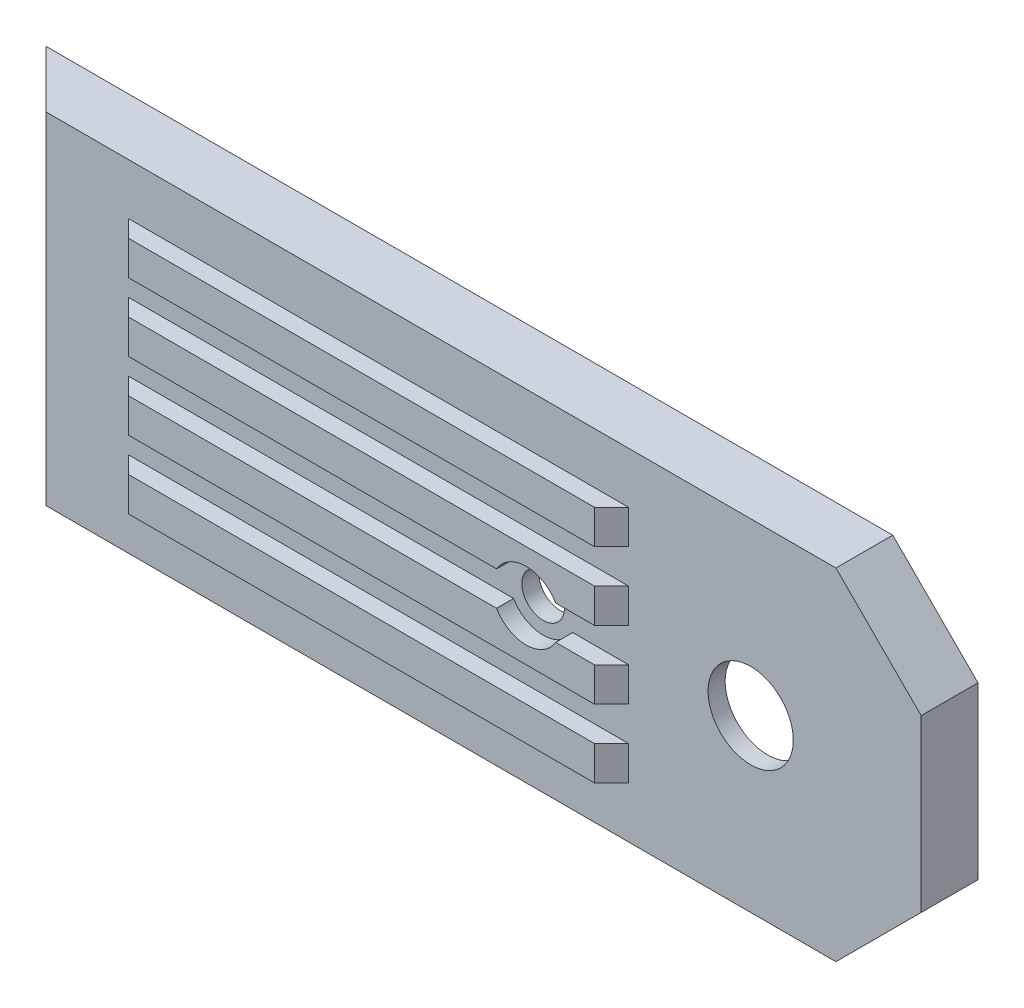
from build123d import *

# Parameters (mm, degrees)
BOSS_EXTRUDE1_DEPTH = 5
CHAMFER1_SIZE       = 5
CUT_EXTRUDE1_DEPTH  = 3.5
SKETCH3_R           = 5
CUT_EXTRUDE2_DEPTH  = 0.75
CHAMFER2_SIZE       = 0.75
SKETCH4_R           = 1.875
SKETCH4_R_2         = 3.75
CUT_EXTRUDE3_DEPTH  = 48.326657393
SKETCH5_W           = 44
SKETCH5_H           = 3
BOSS_EXTRUDE2_DEPTH = 1.5
CHAMFER3_SIZE       = 1.5


with BuildPart() as part:
    # Sketch1 → Boss-Extrude1 (new body)
    with BuildSketch(Plane.XY):
        Polygon((37.25, 15), (44.75, 7.5), (44.75, -7.5), (37.25, -15), (-37.25, -15), (-37.25, 15), align=None)
    extrude(amount=BOSS_EXTRUDE1_DEPTH)

    # Chamfer1
    chamfer1_edges = [part.edges().sort_by_distance(p)[0] for p in [
        (-37.25, 0, 5),
    ]]
    chamfer(chamfer1_edges, length=CHAMFER1_SIZE - 0.0001)  # a hair under: the kernel refuses the full size

    # Sketch2 → Cut-Extrude1 (cut)
    with BuildSketch(Plane(origin=(0, 0, 0), x_dir=(-1, 0, 0), z_dir=(0, 0, -1))):
        with BuildLine():
            Line((-29.75, -11), (6.75, -11))
            ThreePointArc((6.75, -11), (17.75, 0), (6.75, 11))
            Line((6.75, 11), (-29.75, 11))
            ThreePointArc((-29.75, 11), (-40.75, 0), (-29.75, -11))
        make_face()
    extrude(amount=-CUT_EXTRUDE1_DEPTH, mode=Mode.SUBTRACT)

    # Sketch3 → Cut-Extrude2 (cut)
    with BuildSketch(Plane(origin=(0, 0, 3.5), x_dir=(-1, 0, 0), z_dir=(0, 0, -1))):
        with Locations((6.5, 0)):
            Circle(SKETCH3_R)
    extrude(amount=-CUT_EXTRUDE2_DEPTH, mode=Mode.SUBTRACT)

    # Chamfer2
    chamfer2_edges = [part.edges().sort_by_distance(p)[0] for p in [
        (-1.5, 0, 3.5),
    ]]
    chamfer(chamfer2_edges, length=CHAMFER2_SIZE - 0.0001)  # a hair under: the kernel refuses the full size

    # Sketch4 → Cut-Extrude3 (cut, through all)
    with BuildSketch(Plane(origin=(0, 0, 3.5), x_dir=(-1, 0, 0), z_dir=(0, 0, -1))):
        with Locations((-11.49, 0)):
            Circle(SKETCH4_R)
        with Locations((-29.75, 0)):
            Circle(SKETCH4_R_2)
    extrude(amount=-CUT_EXTRUDE3_DEPTH, mode=Mode.SUBTRACT)

    # Sketch5 → Boss-Extrude2 (add)
    with BuildSketch(Plane.XY.offset(5)):
        with Locations((-3, 9)):
            Rectangle(SKETCH5_W, SKETCH5_H)
        with BuildLine():
            Line((-25, 4.5), (19, 4.5))
            Line((19, 4.5), (19, 1.5))
            Line((19, 1.5), (14.088076211, 1.5))
            ThreePointArc((14.088076211, 1.5), (11.49, 3), (8.891923789, 1.5))
            Line((8.891923789, 1.5), (-25, 1.5))
            Line((-25, 1.5), (-25, 4.5))
        make_face()
        with Locations((-3, -9)):
            Rectangle(SKETCH5_W, SKETCH5_H)
        with BuildLine():
            Line((-25, -1.5), (8.891923789, -1.5))
            ThreePointArc((8.891923789, -1.5), (11.49, -3), (14.088076211, -1.5))
            Line((14.088076211, -1.5), (19, -1.5))
            Line((19, -1.5), (19, -4.5))
            Line((19, -4.5), (-25, -4.5))
            Line((-25, -4.5), (-25, -1.5))
        make_face()
    extrude(amount=BOSS_EXTRUDE2_DEPTH)

    # Chamfer3
    chamfer3_edges = [part.edges().sort_by_distance(p)[0] for p in [
        (-25, 9, 6.5),
        (-25, 3, 6.5),
        (-25, -3, 6.5),
        (-25, -9, 6.5),
        (19, -9, 6.5),
        (19, -3, 6.5),
        (19, 3, 6.5),
        (19, 9, 6.5),
    ]]
    chamfer(chamfer3_edges, length=CHAMFER3_SIZE - 0.0001)  # a hair under: the kernel refuses the full size


solid = part.part
